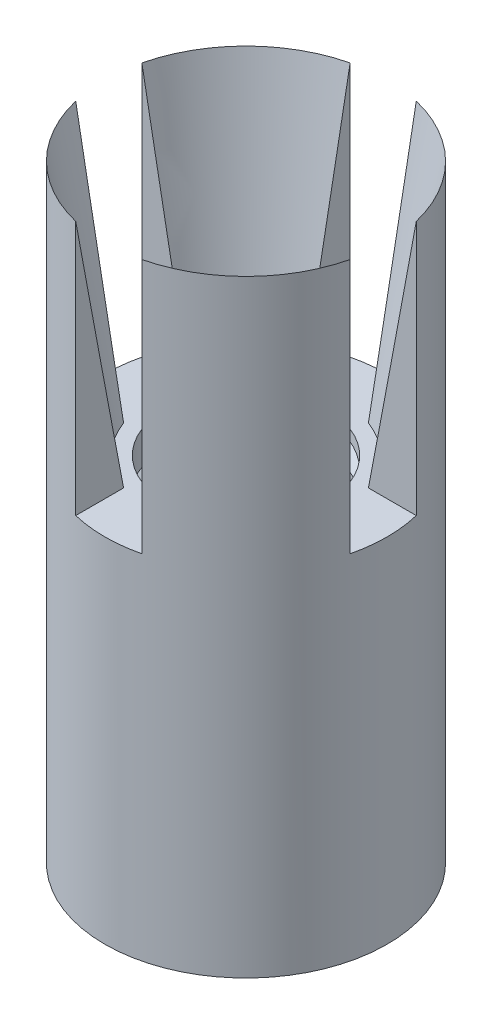
from build123d import *

# Parameters (mm, degrees)
SKETCH1_R               = 5.08
SKETCH1_R_2             = 2.8956
BOSS_EXTRUDE1_DEPTH     = 12.7
SKETCH2_R               = 5.08
BOSS_EXTRUDE2_DEPTH     = 12.7
CUT_EXTRUDE2_DEPTH      = 1.190625
SKETCH3_R               = 3.429
SKETCH4_R               = 5.715
CUT_EXTRUDE4_DEPTH      = 24.021878832
CUT_EXTRUDE4_DEPTH_BACK = 24.021878832
SKETCH8_W               = 2.38125
SKETCH8_H               = 11.08291786
CUT_EXTRUDE5_DEPTH      = 24.021878832
CUT_EXTRUDE5_DEPTH_BACK = 24.021878832
SKETCH9_W               = 2.38125
SKETCH9_H               = 11.406244475
THREAD1_PITCH           = 1.27


with BuildPart() as part:
    # Sketch1 → Boss-Extrude1 (new body)
    with BuildSketch(Plane(origin=(0, 0, 0), x_dir=(1, 0, 0), z_dir=(0, 1, 0))):
        with Locations(Location((0, 0, 0), (0, 0, 270))):
            Circle(SKETCH1_R)
        with Locations(Location((0, 0, 0), (0, 0, 270))):
            Circle(SKETCH1_R_2, mode=Mode.SUBTRACT)
    extrude(amount=BOSS_EXTRUDE1_DEPTH)

    # Sketch2 → Boss-Extrude2 (add)
    with BuildSketch(Plane(origin=(0, 12.7, 0), x_dir=(1, 0, 0), z_dir=(0, 1, 0))):
        with Locations(Location((0, 0, 0), (0, 0, 270))):
            Circle(SKETCH2_R)
    extrude(amount=BOSS_EXTRUDE2_DEPTH)

    # Sketch6 → Cut-Extrude2 (cut, symmetric)
    with BuildSketch(Plane.XY):
        Polygon((-5.715, 12.7), (-5.715, 25.4), (-3.17754, 12.7), align=None)
    extrude(amount=CUT_EXTRUDE2_DEPTH, both=True, mode=Mode.SUBTRACT)

    # Sketch3 → Cut-Loft2 section 0
    with BuildSketch(Plane(origin=(0, 12.7, 0), x_dir=(1, 0, 0), z_dir=(0, 1, 0))):
        Circle(SKETCH3_R)
    # Sketch4 → Cut-Loft2 section 1
    with BuildSketch(Plane(origin=(0, 25.4, 0), x_dir=(1, 0, 0), z_dir=(0, 1, 0))):
        Circle(SKETCH4_R)
    loft(mode=Mode.SUBTRACT)

    # Sketch8 → Cut-Extrude4 (cut, two sides: drawn at the far end of the back side and taken through both)
    with BuildSketch(Plane(origin=(0, 0, 0), x_dir=(0, 0, -1), z_dir=(1, 0, 0)).offset(-CUT_EXTRUDE4_DEPTH_BACK)):
        with Locations((0, 18.24145893)):
            Rectangle(SKETCH8_W, SKETCH8_H)
    extrude(amount=CUT_EXTRUDE4_DEPTH + CUT_EXTRUDE4_DEPTH_BACK, mode=Mode.SUBTRACT)

    # Sketch9 → Cut-Extrude5 (cut, two sides: drawn at the far end of the back side and taken through both)
    with BuildSketch(Plane.XY.offset(-CUT_EXTRUDE5_DEPTH_BACK)):
        with Locations((0, 18.403122237)):
            Rectangle(SKETCH9_W, SKETCH9_H)
    extrude(amount=CUT_EXTRUDE5_DEPTH + CUT_EXTRUDE5_DEPTH_BACK, mode=Mode.SUBTRACT)

    # Thread1: the profile of Thread Profile1 profile screwed along a right-hand helix of 10 turns, 8 arcs to a turn; built about Z, then put on its axis
    thread1_z = Axis((0, 0, 0), (0, 0, 1))
    thread1_corners = [(2.8953, 0, -0.000173205), (3.583007661, 0, 0.396874998), (3.583007661, 0, 0.555624998), (2.8953, 0, 0.952673202)]
    with BuildLine(mode=Mode.PRIVATE) as thread1_profile:
        Line(thread1_corners[0], thread1_corners[1])
        Line(thread1_corners[1], thread1_corners[2])
        Line(thread1_corners[2], thread1_corners[3])
        Line(thread1_corners[3], thread1_corners[0])
    thread1_cap = Face(thread1_profile.wire())
    thread1_turn_angles = [0, 22.5, 45, 67.5, 90, 112.5, 135, 157.5, 180, 202.5, 225, 247.5, 270, 292.5, 315, 337.5, 360]
    thread1_turn_weights = [1, 0.9238795325112867, 1, 0.9238795325112867, 1, 0.9238795325112867, 1, 0.9238795325112867, 1, 0.9238795325112867, 1, 0.9238795325112867, 1, 0.9238795325112867, 1, 0.9238795325112867, 1]
    thread1_turn_rails = [Edge.make_bspline([Vector(p[0], p[1], 0).rotate(thread1_z, thread1_turn_angles[k]) / thread1_turn_weights[k] + Vector(0, 0, p[2] + THREAD1_PITCH * thread1_turn_angles[k] / 360) for k in range(17)], [0, 0, 0, 1, 1, 2, 2, 3, 3, 4, 4, 5, 5, 6, 6, 7, 7, 8, 8, 8], 2, thread1_turn_weights) for p in thread1_corners]
    thread1_turn_sides = [Face.make_surface_from_curves(thread1_turn_rails[p[0]], thread1_turn_rails[p[1]]) for p in [(0, 1), (1, 2), (2, 3), (3, 0)]]
    thread1 = Plane(origin=(0, 12.7, 0), x_dir=(-1, 0, 0), z_dir=(0, -1, 0)) * Solid(Shell([*[p.moved(Location((0, 0, THREAD1_PITCH * i))) for i in range(10) for p in thread1_turn_sides], thread1_cap, thread1_cap.rotate(thread1_z, 3600).moved(Location((0, 0, THREAD1_PITCH * 3600 / 360)))]))
    add(thread1, mode=Mode.SUBTRACT)


solid = part.part
